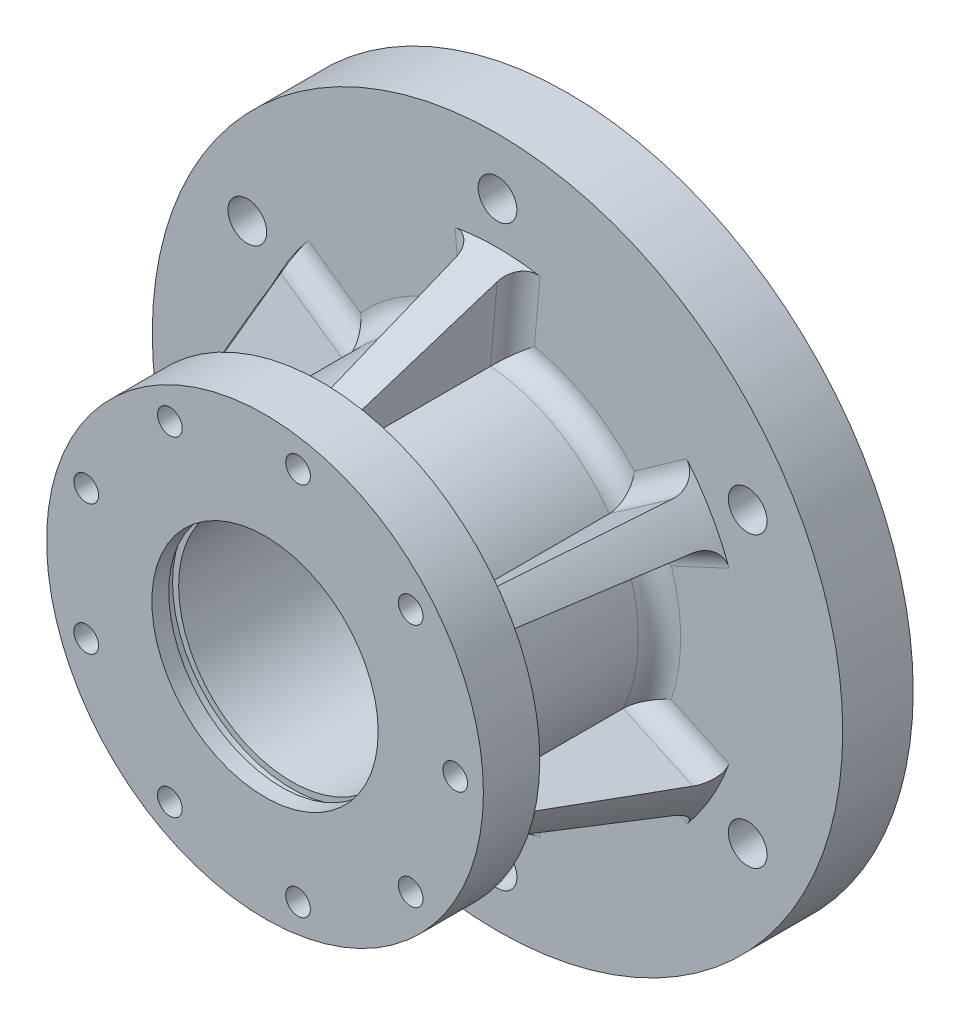
from build123d import *

# Parameters (mm, degrees)
SCHIZZO1_R                   = 49
SCHIZZO1_R_2                 = 35
ESTRUSIONE_ESTRUSIONE1_DEPTH = 10
SCHIZZO2_R                   = 2.75
TAGLIO_ESTRUSIONE1_DEPTH     = 71.014284257
RIPETIZIONECIRCOLARE1_COUNT  = 6
ESTRUSIONE_ESTRUSIONE2_START = -4
SCHIZZO4_R                   = 35
ESTRUSIONE_ESTRUSIONE2_DEPTH = 4
SCHIZZO5_R                   = 23
SCHIZZO5_R_2                 = 16
ESTRUSIONE_ESTRUSIONE3_DEPTH = 33
SCHIZZO6_R                   = 16
TAGLIO_ESTRUSIONE2_DEPTH     = 77.75285011
ESTRUSIONE_ESTRUSIONE4_START = -3
SCHIZZO8_R                   = 16
SCHIZZO8_R_2                 = 14
ESTRUSIONE_ESTRUSIONE4_DEPTH = 2
SMUSSO1_SIZE                 = 4
SMUSSO2_SIZE                 = 2
SCHIZZO9_R                   = 46.5
SCHIZZO9_R_2                 = 35
TAGLIO_ESTRUSIONE4_DEPTH     = 1
RIVOLUZIONE1_ANGLE           = 10
RIPETIZIONECIRCOLARE3_COUNT  = 6
RACCORDO1_R                  = 3
SPOSTA_FACCIA1_BY            = 0.06
SPOSTA_FACCIA1_2_BY          = 0.06
TAGLIO_ESTRUSIONE5_START     = -2.4
SCHIZZO11_R                  = 16.925
TAGLIO_ESTRUSIONE5_DEPTH     = 1.4
ESTRUSIONE_ESTRUSIONE5_START = -8
SCHIZZO12_R                  = 31
SCHIZZO12_R_2                = 23
ESTRUSIONE_ESTRUSIONE5_DEPTH = 8
SCHIZZO13_R                  = 1.75
TAGLIO_ESTRUSIONE6_DEPTH     = 8
TAGLIO_ESTRUSIONE7_DEPTH     = 2.5
RIPETIZIONECIRCOLARE4_COUNT  = 9
RACCORDO2_R                  = 3


with BuildPart() as part:
    # Schizzo1 → Estrusione-Estrusione1 (new body)
    with BuildSketch(Plane.XY):
        Circle(SCHIZZO1_R)
        Circle(SCHIZZO1_R_2, mode=Mode.SUBTRACT)
    extrude(amount=ESTRUSIONE_ESTRUSIONE1_DEPTH)

    # Schizzo2 → Taglio-Estrusione1 (cut, through all)
    with BuildSketch(Plane.XY.offset(10)):
        with Locations((0, 41)):
            Circle(SCHIZZO2_R)
    taglio_estrusione1 = extrude(amount=-TAGLIO_ESTRUSIONE1_DEPTH, mode=Mode.SUBTRACT)

    # RipetizioneCircolare1: Taglio-Estrusione1 ×6 about axis
    ripetizionecircolare1_axis = Axis((0, 0, 0), (0, 0, 1))
    for i in range(1, RIPETIZIONECIRCOLARE1_COUNT):
        add(taglio_estrusione1.rotate(ripetizionecircolare1_axis, i * 360 / RIPETIZIONECIRCOLARE1_COUNT), mode=Mode.SUBTRACT)

    # Schizzo4 → Estrusione-Estrusione2 (add)
    with BuildSketch(Plane.XY.offset(10).offset(ESTRUSIONE_ESTRUSIONE2_START)):
        Circle(SCHIZZO4_R)
    extrude(amount=ESTRUSIONE_ESTRUSIONE2_DEPTH)

    # Schizzo5 → Estrusione-Estrusione3 (add)
    with BuildSketch(Plane.XY.offset(10)):
        Circle(SCHIZZO5_R)
        Circle(SCHIZZO5_R_2, mode=Mode.SUBTRACT)
    extrude(amount=ESTRUSIONE_ESTRUSIONE3_DEPTH)

    # Schizzo6 → Taglio-Estrusione2 (cut, through all)
    with BuildSketch(Plane.XY.offset(10)):
        Circle(SCHIZZO6_R)
    extrude(amount=-TAGLIO_ESTRUSIONE2_DEPTH, mode=Mode.SUBTRACT)

    # Schizzo8 → Estrusione-Estrusione4 (add)
    with BuildSketch(Plane(origin=(0, 0, 6), x_dir=(-1, 0, 0), z_dir=(0, 0, -1)).offset(ESTRUSIONE_ESTRUSIONE4_START)):
        Circle(SCHIZZO8_R)
        Circle(SCHIZZO8_R_2, mode=Mode.SUBTRACT)
    extrude(amount=-ESTRUSIONE_ESTRUSIONE4_DEPTH)

    # Smusso1
    smusso1_edges = [part.edges().sort_by_distance(p)[0] for p in [
        (-35, 0, 6),
    ]]
    chamfer(smusso1_edges, length=SMUSSO1_SIZE)

    # Smusso2
    smusso2_edges = [part.edges().sort_by_distance(p)[0] for p in [
        (-16, 0, 6),
    ]]
    chamfer(smusso2_edges, length=SMUSSO2_SIZE)

    # Schizzo9 → Taglio-Estrusione4 (cut)
    with BuildSketch(Plane(origin=(0, 0, 0), x_dir=(-1, 0, 0), z_dir=(0, 0, -1))):
        Circle(SCHIZZO9_R)
        Circle(SCHIZZO9_R_2, mode=Mode.SUBTRACT)
    extrude(amount=-TAGLIO_ESTRUSIONE4_DEPTH, mode=Mode.SUBTRACT)

    # Schizzo10 → Rivoluzione1 (revolve, symmetric)
    with BuildSketch(Plane(origin=(0, 0, 0), x_dir=(0, 0, -1), z_dir=(1, 0, 0))) as rivoluzione1_sk:
        Polygon((-43, 23), (-10, 35), (-10, 23), align=None)
    rivoluzione1 = revolve(axis=Axis((0, 0, 43), (0, 0, -1)), revolution_arc=RIVOLUZIONE1_ANGLE / 2)
    rivoluzione1 = rivoluzione1 + revolve(rivoluzione1_sk.sketch, axis=Axis((0, 0, 43), (0, 0, 1)), revolution_arc=RIVOLUZIONE1_ANGLE / 2)

    # RipetizioneCircolare3: Rivoluzione1 ×6 about axis
    ripetizionecircolare3_axis = Axis((0, 0, 0), (0, 0, 1))
    for i in range(1, RIPETIZIONECIRCOLARE3_COUNT):
        add(rivoluzione1.rotate(ripetizionecircolare3_axis, i * 360 / RIPETIZIONECIRCOLARE3_COUNT))

    # Raccordo1
    raccordo1_edges = [part.edges().sort_by_distance(p)[0] for p in [
        (-23, 0, 10),
        (-26.282925824, 12.25592959, 10),
        (-23.755409284, 16.633716654, 10),
        (-11.5, -19.918584287, 10),
        (-23.755409284, -16.633716654, 10),
        (-26.282925824, -12.25592959, 10),
        (11.5, -19.918584287, 10),
        (2.52751654, -28.889646245, 10),
        (-2.52751654, -28.889646245, 10),
        (23, 0, 10),
        (26.282925824, -12.25592959, 10),
        (23.755409284, -16.633716654, 10),
        (11.5, 19.918584287, 10),
        (23.755409284, 16.633716654, 10),
        (26.282925824, 12.25592959, 10),
        (-11.5, 19.918584287, 10),
        (-2.52751654, 28.889646245, 10),
        (2.52751654, 28.889646245, 10),
    ]]
    fillet(raccordo1_edges, radius=RACCORDO1_R)

    # Sposta faccia1: a curved face moved inward by 0.06
    add(Solid.thicken(part.faces().sort_by_distance((46.5, 0, 0.5))[0], -SPOSTA_FACCIA1_BY), mode=Mode.SUBTRACT)

    # Sposta faccia1 2: a curved face moved inward by 0.06
    add(Solid.thicken(part.faces().sort_by_distance((-16, 0, 27))[0], -SPOSTA_FACCIA1_2_BY), mode=Mode.SUBTRACT)

    # Schizzo11 → Taglio-Estrusione5 (cut)
    with BuildSketch(Plane.XY.offset(43).offset(TAGLIO_ESTRUSIONE5_START)):
        Circle(SCHIZZO11_R)
    extrude(amount=-TAGLIO_ESTRUSIONE5_DEPTH, mode=Mode.SUBTRACT)

    # Schizzo12 → Estrusione-Estrusione5 (add)
    with BuildSketch(Plane.XY.offset(43).offset(ESTRUSIONE_ESTRUSIONE5_START)):
        Circle(SCHIZZO12_R)
        Circle(SCHIZZO12_R_2, mode=Mode.SUBTRACT)
    extrude(amount=ESTRUSIONE_ESTRUSIONE5_DEPTH)

    # Schizzo13 → Taglio-Estrusione6 (cut)
    with BuildSketch(Plane.XY.offset(43)):
        with Locations((-13.5, 23.382685902)):
            Circle(SCHIZZO13_R)
    taglio_estrusione6 = extrude(amount=-TAGLIO_ESTRUSIONE6_DEPTH, mode=Mode.SUBTRACT)

    # Schizzo14 → Taglio-Estrusione7 (cut)
    with BuildSketch(Plane(origin=(0, 0, 35), x_dir=(-1, 0, 0), z_dir=(0, 0, -1))):
        Polygon((11.883419246, 26.182685902), (10.266838493, 23.382685902), (11.883419246, 20.582685902), (15.116580754, 20.582685902), (16.733161507, 23.382685902), (15.116580754, 26.182685902), align=None)
    taglio_estrusione7 = extrude(amount=-TAGLIO_ESTRUSIONE7_DEPTH, mode=Mode.SUBTRACT)

    # RipetizioneCircolare4: Taglio-Estrusione6, Taglio-Estrusione7 ×9 about axis
    ripetizionecircolare4_axis = Axis((0, 0, 0), (0, 0, 1))
    add([taglio_estrusione6.rotate(ripetizionecircolare4_axis, i * 360 / RIPETIZIONECIRCOLARE4_COUNT) for i in range(1, RIPETIZIONECIRCOLARE4_COUNT)], mode=Mode.SUBTRACT)
    add([taglio_estrusione7.rotate(ripetizionecircolare4_axis, i * 360 / RIPETIZIONECIRCOLARE4_COUNT) for i in range(1, RIPETIZIONECIRCOLARE4_COUNT)], mode=Mode.SUBTRACT)

    # Raccordo2
    # the kernel refuses this fillet: 3 mm, written as the material it adds along each edge
    with BuildSketch(Plane(origin=(0, 0, 35), x_dir=(-0.7231392857577484, 0.6907022320752797, 0), z_dir=(0.6907022320752797, 0.7231392857577484, 0))) as raccordo2_piece_1_section:
        with BuildLine():
            CenterArc((23 + RACCORDO2_R, -RACCORDO2_R), RACCORDO2_R, 90, 90)
            Line((23, -RACCORDO2_R), (23, 0))
            Line((23, 0), (23 + RACCORDO2_R, 0))
        make_face()
    raccordo2_piece_1 = revolve(axis=Axis((0, 0, 35), (0, 0, 1)), revolution_arc=87.371444712, mode=Mode.PRIVATE)
    raccordo2_piece_1 = split(raccordo2_piece_1, bisect_by=Plane(origin=(-20.269988654, -3.574145898, 35), z_dir=(0.984807753012208, 0.17364817766693047, 0)), keep=Keep.TOP, mode=Mode.PRIVATE)
    with BuildSketch(Plane(origin=(0, 0, 35), x_dir=(-0.7231392857577484, 0.6907022320752797, 0), z_dir=(0.6907022320752797, 0.7231392857577484, 0))) as raccordo2_piece_2_section:
        with BuildLine():
            CenterArc((23 + RACCORDO2_R, -RACCORDO2_R), RACCORDO2_R, 90, 90)
            Line((23, -RACCORDO2_R), (23, 0))
            Line((23, 0), (23 + RACCORDO2_R, 0))
        make_face()
    raccordo2_piece_2 = revolve(axis=Axis((0, 0, 35), (0, 0, 1)), revolution_arc=87.371444712, mode=Mode.PRIVATE)
    raccordo2_piece_2 = split(raccordo2_piece_2, bisect_by=Plane(origin=(0.957656401, 2.631139338, 35), z_dir=(0.3420201433256689, 0.9396926207859083, 0)), keep=Keep.TOP, mode=Mode.PRIVATE)
    with BuildSketch(Plane(origin=(0, 0, 35), x_dir=(-0.7231392857577484, 0.6907022320752797, 0), z_dir=(0.6907022320752797, 0.7231392857577484, 0))) as raccordo2_piece_3_section:
        with BuildLine():
            CenterArc((23 + RACCORDO2_R, -RACCORDO2_R), RACCORDO2_R, 90, 90)
            Line((23, -RACCORDO2_R), (23, 0))
            Line((23, 0), (23 + RACCORDO2_R, 0))
        make_face()
    raccordo2_piece_3 = revolve(axis=Axis((0, 0, 35), (0, 0, 1)), revolution_arc=87.371444712, mode=Mode.PRIVATE)
    raccordo2_piece_3 = split(raccordo2_piece_3, bisect_by=Plane(origin=(-0.957656401, -2.631139338, 35), z_dir=(-0.34202014332566805, -0.9396926207859086, 0)), keep=Keep.TOP, mode=Mode.PRIVATE)
    raccordo2_piece_3 = split(raccordo2_piece_3, bisect_by=Plane(origin=(-0.957656401, 2.631139338, 35), z_dir=(-0.3420201433256686, 0.9396926207859085, 0)), keep=Keep.TOP, mode=Mode.PRIVATE)
    with BuildSketch(Plane(origin=(0, 0, 35), x_dir=(-0.7231392857577484, 0.6907022320752797, 0), z_dir=(0.6907022320752797, 0.7231392857577484, 0))) as raccordo2_piece_4_section:
        with BuildLine():
            CenterArc((23 + RACCORDO2_R, -RACCORDO2_R), RACCORDO2_R, 90, 90)
            Line((23, -RACCORDO2_R), (23, 0))
            Line((23, 0), (23 + RACCORDO2_R, 0))
        make_face()
    raccordo2_piece_4 = revolve(axis=Axis((0, 0, 35), (0, 0, 1)), revolution_arc=87.371444712, mode=Mode.PRIVATE)
    raccordo2_piece_4 = split(raccordo2_piece_4, bisect_by=Plane(origin=(-13.230295472, 15.76725216, 35), z_dir=(0.6427876096865394, -0.7660444431189781, 0)), keep=Keep.TOP, mode=Mode.PRIVATE)
    raccordo2_piece_4 = split(raccordo2_piece_4, bisect_by=Plane(origin=(-13.230295472, -15.76725216, 35), z_dir=(0.6427876096865393, 0.7660444431189782, 0)), keep=Keep.TOP, mode=Mode.PRIVATE)
    with BuildSketch(Plane(origin=(0, 0, 35), x_dir=(-0.7231392857577484, 0.6907022320752797, 0), z_dir=(0.6907022320752797, 0.7231392857577484, 0))) as raccordo2_piece_5_section:
        with BuildLine():
            CenterArc((23 + RACCORDO2_R, -RACCORDO2_R), RACCORDO2_R, 90, 90)
            Line((23, -RACCORDO2_R), (23, 0))
            Line((23, 0), (23 + RACCORDO2_R, 0))
        make_face()
    raccordo2_piece_5 = revolve(axis=Axis((0, 0, 35), (0, 0, 1)), revolution_arc=87.371444712, mode=Mode.PRIVATE)
    raccordo2_piece_5 = split(raccordo2_piece_5, bisect_by=Plane(origin=(-20.269988654, 3.574145898, 35), z_dir=(0.9848077530122081, -0.17364817766693044, 0)), keep=Keep.TOP, mode=Mode.PRIVATE)
    with BuildSketch(Plane(origin=(0, 0, 35), x_dir=(-0.7231392857577484, 0.6907022320752797, 0), z_dir=(0.6907022320752797, 0.7231392857577484, 0))) as raccordo2_piece_6_section:
        with BuildLine():
            CenterArc((23 + RACCORDO2_R, -RACCORDO2_R), RACCORDO2_R, 90, 90)
            Line((23, -RACCORDO2_R), (23, 0))
            Line((23, 0), (23 + RACCORDO2_R, 0))
        make_face()
    raccordo2_piece_6 = revolve(axis=Axis((0, 0, 35), (0, 0, 1)), revolution_arc=87.371444712, mode=Mode.PRIVATE)
    raccordo2_piece_6 = split(raccordo2_piece_6, bisect_by=Plane(origin=(0.957656401, -2.631139338, 35), z_dir=(0.3420201433256694, -0.9396926207859082, 0)), keep=Keep.TOP, mode=Mode.PRIVATE)
    with BuildSketch(Plane(origin=(0, 0, 35), x_dir=(0.2365960365489283, 0.9716081079783857, 0), z_dir=(0.9716081079783857, -0.2365960365489283, 0))) as raccordo2_piece_7_section:
        with BuildLine():
            CenterArc((23 + RACCORDO2_R, -RACCORDO2_R), RACCORDO2_R, 90, 90)
            Line((23, -RACCORDO2_R), (23, 0))
            Line((23, 0), (23 + RACCORDO2_R, 0))
        make_face()
    raccordo2_piece_7 = revolve(axis=Axis((0, 0, 35), (0, 0, 1)), revolution_arc=87.371444712, mode=Mode.PRIVATE)
    raccordo2_piece_7 = split(raccordo2_piece_7, bisect_by=Plane(origin=(-20.269988654, -3.574145898, 35), z_dir=(0.984807753012208, 0.17364817766693047, 0)), keep=Keep.TOP, mode=Mode.PRIVATE)
    raccordo2_piece_7 = split(raccordo2_piece_7, bisect_by=Plane(origin=(-7.039693182, 19.341398058, 35), z_dir=(0.3420201433256686, -0.9396926207859084, 0)), keep=Keep.TOP, mode=Mode.PRIVATE)
    with BuildSketch(Plane(origin=(0, 0, 35), x_dir=(0.2365960365489283, 0.9716081079783857, 0), z_dir=(0.9716081079783857, -0.2365960365489283, 0))) as raccordo2_piece_8_section:
        with BuildLine():
            CenterArc((23 + RACCORDO2_R, -RACCORDO2_R), RACCORDO2_R, 90, 90)
            Line((23, -RACCORDO2_R), (23, 0))
            Line((23, 0), (23 + RACCORDO2_R, 0))
        make_face()
    raccordo2_piece_8 = revolve(axis=Axis((0, 0, 35), (0, 0, 1)), revolution_arc=87.371444712, mode=Mode.PRIVATE)
    raccordo2_piece_8 = split(raccordo2_piece_8, bisect_by=Plane(origin=(13.230295472, 15.76725216, 35), z_dir=(-0.6427876096865396, -0.7660444431189778, 0)), keep=Keep.TOP, mode=Mode.PRIVATE)
    raccordo2_piece_8 = split(raccordo2_piece_8, bisect_by=Plane(origin=(-17.825128869, 10.291342951, 35), z_dir=(0.8660254037844388, -0.49999999999999983, 0)), keep=Keep.TOP, mode=Mode.PRIVATE)
    with BuildSketch(Plane(origin=(0, 0, 35), x_dir=(0.2365960365489283, 0.9716081079783857, 0), z_dir=(0.9716081079783857, -0.2365960365489283, 0))) as raccordo2_piece_9_section:
        with BuildLine():
            CenterArc((23 + RACCORDO2_R, -RACCORDO2_R), RACCORDO2_R, 90, 90)
            Line((23, -RACCORDO2_R), (23, 0))
            Line((23, 0), (23 + RACCORDO2_R, 0))
        make_face()
    raccordo2_piece_9 = revolve(axis=Axis((0, 0, 35), (0, 0, 1)), revolution_arc=87.371444712, mode=Mode.PRIVATE)
    raccordo2_piece_9 = split(raccordo2_piece_9, bisect_by=Plane(origin=(-2.757461708, 0.486214897, 35), z_dir=(-0.9848077530122081, 0.17364817766692997, 0)), keep=Keep.TOP, mode=Mode.PRIVATE)
    raccordo2_piece_9 = split(raccordo2_piece_9, bisect_by=Plane(origin=(2.424871131, 1.4, 35), z_dir=(0.8660254037844387, 0.4999999999999999, 0)), keep=Keep.TOP, mode=Mode.PRIVATE)
    with BuildSketch(Plane(origin=(0, 0, 35), x_dir=(0.2365960365489283, 0.9716081079783857, 0), z_dir=(0.9716081079783857, -0.2365960365489283, 0))) as raccordo2_piece_10_section:
        with BuildLine():
            CenterArc((23 + RACCORDO2_R, -RACCORDO2_R), RACCORDO2_R, 90, 90)
            Line((23, -RACCORDO2_R), (23, 0))
            Line((23, 0), (23 + RACCORDO2_R, 0))
        make_face()
    raccordo2_piece_10 = revolve(axis=Axis((0, 0, 35), (0, 0, 1)), revolution_arc=87.371444712, mode=Mode.PRIVATE)
    raccordo2_piece_10 = split(raccordo2_piece_10, bisect_by=Plane(origin=(0.957656401, 2.631139338, 35), z_dir=(0.3420201433256689, 0.9396926207859083, 0)), keep=Keep.TOP, mode=Mode.PRIVATE)
    raccordo2_piece_10 = split(raccordo2_piece_10, bisect_by=Plane(origin=(-2.424871131, -1.4, 35), z_dir=(-0.8660254037844383, -0.5000000000000007, 0)), keep=Keep.TOP, mode=Mode.PRIVATE)
    with BuildSketch(Plane(origin=(0, 0, 35), x_dir=(0.2365960365489283, 0.9716081079783857, 0), z_dir=(0.9716081079783857, -0.2365960365489283, 0))) as raccordo2_piece_11_section:
        with BuildLine():
            CenterArc((23 + RACCORDO2_R, -RACCORDO2_R), RACCORDO2_R, 90, 90)
            Line((23, -RACCORDO2_R), (23, 0))
            Line((23, 0), (23 + RACCORDO2_R, 0))
        make_face()
    raccordo2_piece_11 = revolve(axis=Axis((0, 0, 35), (0, 0, 1)), revolution_arc=87.371444712, mode=Mode.PRIVATE)
    raccordo2_piece_11 = split(raccordo2_piece_11, bisect_by=Plane(origin=(-2.424871131, -1.4, 35), z_dir=(0.8660254037844383, 0.5000000000000007, 0)), keep=Keep.TOP, mode=Mode.PRIVATE)
    raccordo2_piece_11 = split(raccordo2_piece_11, bisect_by=Plane(origin=(0, 20.582685902, 35), z_dir=(0, -1, 0)), keep=Keep.TOP, mode=Mode.PRIVATE)
    with BuildSketch(Plane(origin=(0, 0, 35), x_dir=(0.2365960365489283, 0.9716081079783857, 0), z_dir=(0.9716081079783857, -0.2365960365489283, 0))) as raccordo2_piece_12_section:
        with BuildLine():
            CenterArc((23 + RACCORDO2_R, -RACCORDO2_R), RACCORDO2_R, 90, 90)
            Line((23, -RACCORDO2_R), (23, 0))
            Line((23, 0), (23 + RACCORDO2_R, 0))
        make_face()
    raccordo2_piece_12 = revolve(axis=Axis((0, 0, 35), (0, 0, 1)), revolution_arc=87.371444712, mode=Mode.PRIVATE)
    raccordo2_piece_12 = split(raccordo2_piece_12, bisect_by=Plane(origin=(-13.230295472, 15.76725216, 35), z_dir=(0.6427876096865394, -0.7660444431189781, 0)), keep=Keep.TOP, mode=Mode.PRIVATE)
    raccordo2_piece_12 = split(raccordo2_piece_12, bisect_by=Plane(origin=(0, 20.582685902, 35), z_dir=(0, -1, 0)), keep=Keep.TOP, mode=Mode.PRIVATE)
    with BuildSketch(Plane(origin=(0, 0, 35), x_dir=(0.9597353223066748, 0.28090587590312716, 0), z_dir=(0.28090587590312716, -0.9597353223066748, 0))) as raccordo2_piece_13_section:
        with BuildLine():
            CenterArc((23 + RACCORDO2_R, -RACCORDO2_R), RACCORDO2_R, 90, 90)
            Line((23, -RACCORDO2_R), (23, 0))
            Line((23, 0), (23 + RACCORDO2_R, 0))
        make_face()
    raccordo2_piece_13 = revolve(axis=Axis((0, 0, 35), (0, 0, 1)), revolution_arc=87.371444712, mode=Mode.PRIVATE)
    raccordo2_piece_13 = split(raccordo2_piece_13, bisect_by=Plane(origin=(7.039693182, 19.341398058, 35), z_dir=(-0.34202014332566893, -0.9396926207859084, 0)), keep=Keep.TOP, mode=Mode.PRIVATE)
    with BuildSketch(Plane(origin=(0, 0, 35), x_dir=(0.9597353223066748, 0.28090587590312716, 0), z_dir=(0.28090587590312716, -0.9597353223066748, 0))) as raccordo2_piece_14_section:
        with BuildLine():
            CenterArc((23 + RACCORDO2_R, -RACCORDO2_R), RACCORDO2_R, 90, 90)
            Line((23, -RACCORDO2_R), (23, 0))
            Line((23, 0), (23 + RACCORDO2_R, 0))
        make_face()
    raccordo2_piece_14 = revolve(axis=Axis((0, 0, 35), (0, 0, 1)), revolution_arc=87.371444712, mode=Mode.PRIVATE)
    raccordo2_piece_14 = split(raccordo2_piece_14, bisect_by=Plane(origin=(1.799805307, -2.144924441, 35), z_dir=(0.6427876096865389, -0.7660444431189785, 0)), keep=Keep.TOP, mode=Mode.PRIVATE)
    with BuildSketch(Plane(origin=(0, 0, 35), x_dir=(0.9597353223066748, 0.28090587590312716, 0), z_dir=(0.28090587590312716, -0.9597353223066748, 0))) as raccordo2_piece_15_section:
        with BuildLine():
            CenterArc((23 + RACCORDO2_R, -RACCORDO2_R), RACCORDO2_R, 90, 90)
            Line((23, -RACCORDO2_R), (23, 0))
            Line((23, 0), (23 + RACCORDO2_R, 0))
        make_face()
    raccordo2_piece_15 = revolve(axis=Axis((0, 0, 35), (0, 0, 1)), revolution_arc=87.371444712, mode=Mode.PRIVATE)
    raccordo2_piece_15 = split(raccordo2_piece_15, bisect_by=Plane(origin=(-1.799805307, 2.144924441, 35), z_dir=(-0.6427876096865397, 0.7660444431189779, 0)), keep=Keep.TOP, mode=Mode.PRIVATE)
    raccordo2_piece_15 = split(raccordo2_piece_15, bisect_by=Plane(origin=(2.757461708, -0.486214897, 35), z_dir=(0.984807753012208, -0.1736481776669308, 0)), keep=Keep.TOP, mode=Mode.PRIVATE)
    with BuildSketch(Plane(origin=(0, 0, 35), x_dir=(0.9597353223066748, 0.28090587590312716, 0), z_dir=(0.28090587590312716, -0.9597353223066748, 0))) as raccordo2_piece_16_section:
        with BuildLine():
            CenterArc((23 + RACCORDO2_R, -RACCORDO2_R), RACCORDO2_R, 90, 90)
            Line((23, -RACCORDO2_R), (23, 0))
            Line((23, 0), (23 + RACCORDO2_R, 0))
        make_face()
    raccordo2_piece_16 = revolve(axis=Axis((0, 0, 35), (0, 0, 1)), revolution_arc=87.371444712, mode=Mode.PRIVATE)
    raccordo2_piece_16 = split(raccordo2_piece_16, bisect_by=Plane(origin=(20.269988654, 3.574145898, 35), z_dir=(-0.9848077530122081, -0.17364817766692997, 0)), keep=Keep.TOP, mode=Mode.PRIVATE)
    raccordo2_piece_16 = split(raccordo2_piece_16, bisect_by=Plane(origin=(-7.039693182, 19.341398058, 35), z_dir=(0.3420201433256686, -0.9396926207859084, 0)), keep=Keep.TOP, mode=Mode.PRIVATE)
    with BuildSketch(Plane(origin=(0, 0, 35), x_dir=(0.9597353223066748, 0.28090587590312716, 0), z_dir=(0.28090587590312716, -0.9597353223066748, 0))) as raccordo2_piece_17_section:
        with BuildLine():
            CenterArc((23 + RACCORDO2_R, -RACCORDO2_R), RACCORDO2_R, 90, 90)
            Line((23, -RACCORDO2_R), (23, 0))
            Line((23, 0), (23 + RACCORDO2_R, 0))
        make_face()
    raccordo2_piece_17 = revolve(axis=Axis((0, 0, 35), (0, 0, 1)), revolution_arc=87.371444712, mode=Mode.PRIVATE)
    raccordo2_piece_17 = split(raccordo2_piece_17, bisect_by=Plane(origin=(13.230295472, 15.76725216, 35), z_dir=(-0.6427876096865396, -0.7660444431189778, 0)), keep=Keep.TOP, mode=Mode.PRIVATE)
    with BuildSketch(Plane(origin=(0, 0, 35), x_dir=(0.9597353223066748, 0.28090587590312716, 0), z_dir=(0.28090587590312716, -0.9597353223066748, 0))) as raccordo2_piece_18_section:
        with BuildLine():
            CenterArc((23 + RACCORDO2_R, -RACCORDO2_R), RACCORDO2_R, 90, 90)
            Line((23, -RACCORDO2_R), (23, 0))
            Line((23, 0), (23 + RACCORDO2_R, 0))
        make_face()
    raccordo2_piece_18 = revolve(axis=Axis((0, 0, 35), (0, 0, 1)), revolution_arc=87.371444712, mode=Mode.PRIVATE)
    raccordo2_piece_18 = split(raccordo2_piece_18, bisect_by=Plane(origin=(-2.757461708, 0.486214897, 35), z_dir=(-0.9848077530122081, 0.17364817766692997, 0)), keep=Keep.TOP, mode=Mode.PRIVATE)
    with BuildSketch(Plane(origin=(0, 0, 35), x_dir=(0.723139285757743, -0.6907022320752852, 0), z_dir=(-0.6907022320752852, -0.723139285757743, 0))) as raccordo2_piece_19_section:
        with BuildLine():
            CenterArc((23 + RACCORDO2_R, -RACCORDO2_R), RACCORDO2_R, 90, 90)
            Line((23, -RACCORDO2_R), (23, 0))
            Line((23, 0), (23 + RACCORDO2_R, 0))
        make_face()
    raccordo2_piece_19 = revolve(axis=Axis((0, 0, 35), (0, 0, 1)), revolution_arc=87.371444712, mode=Mode.PRIVATE)
    raccordo2_piece_19 = split(raccordo2_piece_19, bisect_by=Plane(origin=(7.039693182, 19.341398058, 35), z_dir=(-0.34202014332566893, -0.9396926207859084, 0)), keep=Keep.TOP, mode=Mode.PRIVATE)
    raccordo2_piece_19 = split(raccordo2_piece_19, bisect_by=Plane(origin=(20.269988654, -3.574145898, 35), z_dir=(-0.9848077530122081, 0.1736481776669302, 0)), keep=Keep.TOP, mode=Mode.PRIVATE)
    with BuildSketch(Plane(origin=(0, 0, 35), x_dir=(0.723139285757743, -0.6907022320752852, 0), z_dir=(-0.6907022320752852, -0.723139285757743, 0))) as raccordo2_piece_20_section:
        with BuildLine():
            CenterArc((23 + RACCORDO2_R, -RACCORDO2_R), RACCORDO2_R, 90, 90)
            Line((23, -RACCORDO2_R), (23, 0))
            Line((23, 0), (23 + RACCORDO2_R, 0))
        make_face()
    raccordo2_piece_20 = revolve(axis=Axis((0, 0, 35), (0, 0, 1)), revolution_arc=87.371444712, mode=Mode.PRIVATE)
    raccordo2_piece_20 = split(raccordo2_piece_20, bisect_by=Plane(origin=(7.039693182, -19.341398058, 35), z_dir=(-0.34202014332566866, 0.9396926207859084, 0)), keep=Keep.TOP, mode=Mode.PRIVATE)
    raccordo2_piece_20 = split(raccordo2_piece_20, bisect_by=Plane(origin=(17.825128869, 10.291342951, 35), z_dir=(-0.8660254037844388, -0.4999999999999998, 0)), keep=Keep.TOP, mode=Mode.PRIVATE)
    with BuildSketch(Plane(origin=(0, 0, 35), x_dir=(0.723139285757743, -0.6907022320752852, 0), z_dir=(-0.6907022320752852, -0.723139285757743, 0))) as raccordo2_piece_21_section:
        with BuildLine():
            CenterArc((23 + RACCORDO2_R, -RACCORDO2_R), RACCORDO2_R, 90, 90)
            Line((23, -RACCORDO2_R), (23, 0))
            Line((23, 0), (23 + RACCORDO2_R, 0))
        make_face()
    raccordo2_piece_21 = revolve(axis=Axis((0, 0, 35), (0, 0, 1)), revolution_arc=87.371444712, mode=Mode.PRIVATE)
    raccordo2_piece_21 = split(raccordo2_piece_21, bisect_by=Plane(origin=(1.799805307, 2.144924441, 35), z_dir=(0.6427876096865388, 0.7660444431189785, 0)), keep=Keep.TOP, mode=Mode.PRIVATE)
    raccordo2_piece_21 = split(raccordo2_piece_21, bisect_by=Plane(origin=(0, -2.8, 35), z_dir=(0, -1, 0)), keep=Keep.TOP, mode=Mode.PRIVATE)
    with BuildSketch(Plane(origin=(0, 0, 35), x_dir=(0.723139285757743, -0.6907022320752852, 0), z_dir=(-0.6907022320752852, -0.723139285757743, 0))) as raccordo2_piece_22_section:
        with BuildLine():
            CenterArc((23 + RACCORDO2_R, -RACCORDO2_R), RACCORDO2_R, 90, 90)
            Line((23, -RACCORDO2_R), (23, 0))
            Line((23, 0), (23 + RACCORDO2_R, 0))
        make_face()
    raccordo2_piece_22 = revolve(axis=Axis((0, 0, 35), (0, 0, 1)), revolution_arc=87.371444712, mode=Mode.PRIVATE)
    raccordo2_piece_22 = split(raccordo2_piece_22, bisect_by=Plane(origin=(1.799805307, -2.144924441, 35), z_dir=(0.6427876096865389, -0.7660444431189785, 0)), keep=Keep.TOP, mode=Mode.PRIVATE)
    raccordo2_piece_22 = split(raccordo2_piece_22, bisect_by=Plane(origin=(0, 2.8, 35), z_dir=(0, 1, 0)), keep=Keep.TOP, mode=Mode.PRIVATE)
    with BuildSketch(Plane(origin=(0, 0, 35), x_dir=(0.723139285757743, -0.6907022320752852, 0), z_dir=(-0.6907022320752852, -0.723139285757743, 0))) as raccordo2_piece_23_section:
        with BuildLine():
            CenterArc((23 + RACCORDO2_R, -RACCORDO2_R), RACCORDO2_R, 90, 90)
            Line((23, -RACCORDO2_R), (23, 0))
            Line((23, 0), (23 + RACCORDO2_R, 0))
        make_face()
    raccordo2_piece_23 = revolve(axis=Axis((0, 0, 35), (0, 0, 1)), revolution_arc=87.371444712, mode=Mode.PRIVATE)
    raccordo2_piece_23 = split(raccordo2_piece_23, bisect_by=Plane(origin=(0, 2.8, 35), z_dir=(0, -1, 0)), keep=Keep.TOP, mode=Mode.PRIVATE)
    raccordo2_piece_23 = split(raccordo2_piece_23, bisect_by=Plane(origin=(17.825128869, -10.291342951, 35), z_dir=(-0.8660254037844384, 0.5000000000000004, 0)), keep=Keep.TOP, mode=Mode.PRIVATE)
    with BuildSketch(Plane(origin=(0, 0, 35), x_dir=(0.723139285757743, -0.6907022320752852, 0), z_dir=(-0.6907022320752852, -0.723139285757743, 0))) as raccordo2_piece_24_section:
        with BuildLine():
            CenterArc((23 + RACCORDO2_R, -RACCORDO2_R), RACCORDO2_R, 90, 90)
            Line((23, -RACCORDO2_R), (23, 0))
            Line((23, 0), (23 + RACCORDO2_R, 0))
        make_face()
    raccordo2_piece_24 = revolve(axis=Axis((0, 0, 35), (0, 0, 1)), revolution_arc=87.371444712, mode=Mode.PRIVATE)
    raccordo2_piece_24 = split(raccordo2_piece_24, bisect_by=Plane(origin=(20.269988654, 3.574145898, 35), z_dir=(-0.9848077530122081, -0.17364817766692997, 0)), keep=Keep.TOP, mode=Mode.PRIVATE)
    raccordo2_piece_24 = split(raccordo2_piece_24, bisect_by=Plane(origin=(17.825128869, -10.291342951, 35), z_dir=(-0.8660254037844384, 0.5000000000000004, 0)), keep=Keep.TOP, mode=Mode.PRIVATE)
    with BuildSketch(Plane(origin=(0, 0, 35), x_dir=(-0.23659603654888095, -0.9716081079783971, 0), z_dir=(-0.9716081079783971, 0.23659603654888095, 0))) as raccordo2_piece_25_section:
        with BuildLine():
            CenterArc((23 + RACCORDO2_R, -RACCORDO2_R), RACCORDO2_R, 90, 90)
            Line((23, -RACCORDO2_R), (23, 0))
            Line((23, 0), (23 + RACCORDO2_R, 0))
        make_face()
    raccordo2_piece_25 = revolve(axis=Axis((0, 0, 35), (0, 0, 1)), revolution_arc=87.371444712, mode=Mode.PRIVATE)
    raccordo2_piece_25 = split(raccordo2_piece_25, bisect_by=Plane(origin=(13.230295472, -15.76725216, 35), z_dir=(-0.6427876096865395, 0.7660444431189781, 0)), keep=Keep.TOP, mode=Mode.PRIVATE)
    with BuildSketch(Plane(origin=(0, 0, 35), x_dir=(-0.23659603654888095, -0.9716081079783971, 0), z_dir=(-0.9716081079783971, 0.23659603654888095, 0))) as raccordo2_piece_26_section:
        with BuildLine():
            CenterArc((23 + RACCORDO2_R, -RACCORDO2_R), RACCORDO2_R, 90, 90)
            Line((23, -RACCORDO2_R), (23, 0))
            Line((23, 0), (23 + RACCORDO2_R, 0))
        make_face()
    raccordo2_piece_26 = revolve(axis=Axis((0, 0, 35), (0, 0, 1)), revolution_arc=87.371444712, mode=Mode.PRIVATE)
    raccordo2_piece_26 = split(raccordo2_piece_26, bisect_by=Plane(origin=(-2.757461708, -0.486214897, 35), z_dir=(-0.9848077530122082, -0.17364817766693014, 0)), keep=Keep.TOP, mode=Mode.PRIVATE)
    with BuildSketch(Plane(origin=(0, 0, 35), x_dir=(-0.23659603654888095, -0.9716081079783971, 0), z_dir=(-0.9716081079783971, 0.23659603654888095, 0))) as raccordo2_piece_27_section:
        with BuildLine():
            CenterArc((23 + RACCORDO2_R, -RACCORDO2_R), RACCORDO2_R, 90, 90)
            Line((23, -RACCORDO2_R), (23, 0))
            Line((23, 0), (23 + RACCORDO2_R, 0))
        make_face()
    raccordo2_piece_27 = revolve(axis=Axis((0, 0, 35), (0, 0, 1)), revolution_arc=87.371444712, mode=Mode.PRIVATE)
    raccordo2_piece_27 = split(raccordo2_piece_27, bisect_by=Plane(origin=(2.757461708, 0.486214897, 35), z_dir=(0.984807753012208, 0.17364817766693097, 0)), keep=Keep.TOP, mode=Mode.PRIVATE)
    raccordo2_piece_27 = split(raccordo2_piece_27, bisect_by=Plane(origin=(-1.799805307, -2.144924441, 35), z_dir=(-0.6427876096865395, -0.7660444431189779, 0)), keep=Keep.TOP, mode=Mode.PRIVATE)
    with BuildSketch(Plane(origin=(0, 0, 35), x_dir=(-0.23659603654888095, -0.9716081079783971, 0), z_dir=(-0.9716081079783971, 0.23659603654888095, 0))) as raccordo2_piece_28_section:
        with BuildLine():
            CenterArc((23 + RACCORDO2_R, -RACCORDO2_R), RACCORDO2_R, 90, 90)
            Line((23, -RACCORDO2_R), (23, 0))
            Line((23, 0), (23 + RACCORDO2_R, 0))
        make_face()
    raccordo2_piece_28 = revolve(axis=Axis((0, 0, 35), (0, 0, 1)), revolution_arc=87.371444712, mode=Mode.PRIVATE)
    raccordo2_piece_28 = split(raccordo2_piece_28, bisect_by=Plane(origin=(-7.039693182, -19.341398058, 35), z_dir=(0.3420201433256689, 0.9396926207859084, 0)), keep=Keep.TOP, mode=Mode.PRIVATE)
    raccordo2_piece_28 = split(raccordo2_piece_28, bisect_by=Plane(origin=(20.269988654, -3.574145898, 35), z_dir=(-0.9848077530122081, 0.1736481776669302, 0)), keep=Keep.TOP, mode=Mode.PRIVATE)
    with BuildSketch(Plane(origin=(0, 0, 35), x_dir=(-0.23659603654888095, -0.9716081079783971, 0), z_dir=(-0.9716081079783971, 0.23659603654888095, 0))) as raccordo2_piece_29_section:
        with BuildLine():
            CenterArc((23 + RACCORDO2_R, -RACCORDO2_R), RACCORDO2_R, 90, 90)
            Line((23, -RACCORDO2_R), (23, 0))
            Line((23, 0), (23 + RACCORDO2_R, 0))
        make_face()
    raccordo2_piece_29 = revolve(axis=Axis((0, 0, 35), (0, 0, 1)), revolution_arc=87.371444712, mode=Mode.PRIVATE)
    raccordo2_piece_29 = split(raccordo2_piece_29, bisect_by=Plane(origin=(7.039693182, -19.341398058, 35), z_dir=(-0.34202014332566866, 0.9396926207859084, 0)), keep=Keep.TOP, mode=Mode.PRIVATE)
    with BuildSketch(Plane(origin=(0, 0, 35), x_dir=(-0.23659603654888095, -0.9716081079783971, 0), z_dir=(-0.9716081079783971, 0.23659603654888095, 0))) as raccordo2_piece_30_section:
        with BuildLine():
            CenterArc((23 + RACCORDO2_R, -RACCORDO2_R), RACCORDO2_R, 90, 90)
            Line((23, -RACCORDO2_R), (23, 0))
            Line((23, 0), (23 + RACCORDO2_R, 0))
        make_face()
    raccordo2_piece_30 = revolve(axis=Axis((0, 0, 35), (0, 0, 1)), revolution_arc=87.371444712, mode=Mode.PRIVATE)
    raccordo2_piece_30 = split(raccordo2_piece_30, bisect_by=Plane(origin=(1.799805307, 2.144924441, 35), z_dir=(0.6427876096865388, 0.7660444431189785, 0)), keep=Keep.TOP, mode=Mode.PRIVATE)
    with BuildSketch(Plane(origin=(0, 0, 35), x_dir=(-0.95973532230667, -0.28090587590314325, 0), z_dir=(-0.28090587590314325, 0.95973532230667, 0))) as raccordo2_piece_31_section:
        with BuildLine():
            CenterArc((23 + RACCORDO2_R, -RACCORDO2_R), RACCORDO2_R, 90, 90)
            Line((23, -RACCORDO2_R), (23, 0))
            Line((23, 0), (23 + RACCORDO2_R, 0))
        make_face()
    raccordo2_piece_31 = revolve(axis=Axis((0, 0, 35), (0, 0, 1)), revolution_arc=87.371444712, mode=Mode.PRIVATE)
    raccordo2_piece_31 = split(raccordo2_piece_31, bisect_by=Plane(origin=(-13.230295472, -15.76725216, 35), z_dir=(0.6427876096865393, 0.7660444431189782, 0)), keep=Keep.TOP, mode=Mode.PRIVATE)
    raccordo2_piece_31 = split(raccordo2_piece_31, bisect_by=Plane(origin=(13.230295472, -15.76725216, 35), z_dir=(-0.6427876096865395, 0.7660444431189781, 0)), keep=Keep.TOP, mode=Mode.PRIVATE)
    with BuildSketch(Plane(origin=(0, 0, 35), x_dir=(-0.95973532230667, -0.28090587590314325, 0), z_dir=(-0.28090587590314325, 0.95973532230667, 0))) as raccordo2_piece_32_section:
        with BuildLine():
            CenterArc((23 + RACCORDO2_R, -RACCORDO2_R), RACCORDO2_R, 90, 90)
            Line((23, -RACCORDO2_R), (23, 0))
            Line((23, 0), (23 + RACCORDO2_R, 0))
        make_face()
    raccordo2_piece_32 = revolve(axis=Axis((0, 0, 35), (0, 0, 1)), revolution_arc=87.371444712, mode=Mode.PRIVATE)
    raccordo2_piece_32 = split(raccordo2_piece_32, bisect_by=Plane(origin=(0, -20.582685902, 35), z_dir=(0, 1, 0)), keep=Keep.TOP, mode=Mode.PRIVATE)
    raccordo2_piece_32 = split(raccordo2_piece_32, bisect_by=Plane(origin=(-20.269988654, 3.574145898, 35), z_dir=(0.9848077530122081, -0.17364817766693044, 0)), keep=Keep.TOP, mode=Mode.PRIVATE)
    with BuildSketch(Plane(origin=(0, 0, 35), x_dir=(-0.95973532230667, -0.28090587590314325, 0), z_dir=(-0.28090587590314325, 0.95973532230667, 0))) as raccordo2_piece_33_section:
        with BuildLine():
            CenterArc((23 + RACCORDO2_R, -RACCORDO2_R), RACCORDO2_R, 90, 90)
            Line((23, -RACCORDO2_R), (23, 0))
            Line((23, 0), (23 + RACCORDO2_R, 0))
        make_face()
    raccordo2_piece_33 = revolve(axis=Axis((0, 0, 35), (0, 0, 1)), revolution_arc=87.371444712, mode=Mode.PRIVATE)
    raccordo2_piece_33 = split(raccordo2_piece_33, bisect_by=Plane(origin=(-2.424871131, 1.4, 35), z_dir=(-0.8660254037844385, 0.5000000000000003, 0)), keep=Keep.TOP, mode=Mode.PRIVATE)
    raccordo2_piece_33 = split(raccordo2_piece_33, bisect_by=Plane(origin=(0.957656401, -2.631139338, 35), z_dir=(0.3420201433256694, -0.9396926207859082, 0)), keep=Keep.TOP, mode=Mode.PRIVATE)
    with BuildSketch(Plane(origin=(0, 0, 35), x_dir=(-0.95973532230667, -0.28090587590314325, 0), z_dir=(-0.28090587590314325, 0.95973532230667, 0))) as raccordo2_piece_34_section:
        with BuildLine():
            CenterArc((23 + RACCORDO2_R, -RACCORDO2_R), RACCORDO2_R, 90, 90)
            Line((23, -RACCORDO2_R), (23, 0))
            Line((23, 0), (23 + RACCORDO2_R, 0))
        make_face()
    raccordo2_piece_34 = revolve(axis=Axis((0, 0, 35), (0, 0, 1)), revolution_arc=87.371444712, mode=Mode.PRIVATE)
    raccordo2_piece_34 = split(raccordo2_piece_34, bisect_by=Plane(origin=(2.424871131, -1.4, 35), z_dir=(0.8660254037844389, -0.4999999999999995, 0)), keep=Keep.TOP, mode=Mode.PRIVATE)
    raccordo2_piece_34 = split(raccordo2_piece_34, bisect_by=Plane(origin=(-2.757461708, -0.486214897, 35), z_dir=(-0.9848077530122082, -0.17364817766693014, 0)), keep=Keep.TOP, mode=Mode.PRIVATE)
    with BuildSketch(Plane(origin=(0, 0, 35), x_dir=(-0.95973532230667, -0.28090587590314325, 0), z_dir=(-0.28090587590314325, 0.95973532230667, 0))) as raccordo2_piece_35_section:
        with BuildLine():
            CenterArc((23 + RACCORDO2_R, -RACCORDO2_R), RACCORDO2_R, 90, 90)
            Line((23, -RACCORDO2_R), (23, 0))
            Line((23, 0), (23 + RACCORDO2_R, 0))
        make_face()
    raccordo2_piece_35 = revolve(axis=Axis((0, 0, 35), (0, 0, 1)), revolution_arc=87.371444712, mode=Mode.PRIVATE)
    raccordo2_piece_35 = split(raccordo2_piece_35, bisect_by=Plane(origin=(-17.825128869, -10.291342951, 35), z_dir=(0.8660254037844388, 0.49999999999999983, 0)), keep=Keep.TOP, mode=Mode.PRIVATE)
    raccordo2_piece_35 = split(raccordo2_piece_35, bisect_by=Plane(origin=(13.230295472, -15.76725216, 35), z_dir=(-0.6427876096865395, 0.7660444431189781, 0)), keep=Keep.TOP, mode=Mode.PRIVATE)
    with BuildSketch(Plane(origin=(0, 0, 35), x_dir=(-0.95973532230667, -0.28090587590314325, 0), z_dir=(-0.28090587590314325, 0.95973532230667, 0))) as raccordo2_piece_36_section:
        with BuildLine():
            CenterArc((23 + RACCORDO2_R, -RACCORDO2_R), RACCORDO2_R, 90, 90)
            Line((23, -RACCORDO2_R), (23, 0))
            Line((23, 0), (23 + RACCORDO2_R, 0))
        make_face()
    raccordo2_piece_36 = revolve(axis=Axis((0, 0, 35), (0, 0, 1)), revolution_arc=87.371444712, mode=Mode.PRIVATE)
    raccordo2_piece_36 = split(raccordo2_piece_36, bisect_by=Plane(origin=(-7.039693182, -19.341398058, 35), z_dir=(0.3420201433256689, 0.9396926207859084, 0)), keep=Keep.TOP, mode=Mode.PRIVATE)
    raccordo2_piece_36 = split(raccordo2_piece_36, bisect_by=Plane(origin=(13.230295472, -15.76725216, 35), z_dir=(0.6427876096865395, -0.7660444431189781, 0)), keep=Keep.TOP, mode=Mode.PRIVATE)
    add([raccordo2_piece_1, raccordo2_piece_2, raccordo2_piece_3, raccordo2_piece_4, raccordo2_piece_5, raccordo2_piece_6, raccordo2_piece_7, raccordo2_piece_8, raccordo2_piece_9, raccordo2_piece_10, raccordo2_piece_11, raccordo2_piece_12, raccordo2_piece_13, raccordo2_piece_14, raccordo2_piece_15, raccordo2_piece_16, raccordo2_piece_17, raccordo2_piece_18, raccordo2_piece_19, raccordo2_piece_20, raccordo2_piece_21, raccordo2_piece_22, raccordo2_piece_23, raccordo2_piece_24, raccordo2_piece_25, raccordo2_piece_26, raccordo2_piece_27, raccordo2_piece_28, raccordo2_piece_29, raccordo2_piece_30, raccordo2_piece_31, raccordo2_piece_32, raccordo2_piece_33, raccordo2_piece_34, raccordo2_piece_35, raccordo2_piece_36])


solid = part.part
